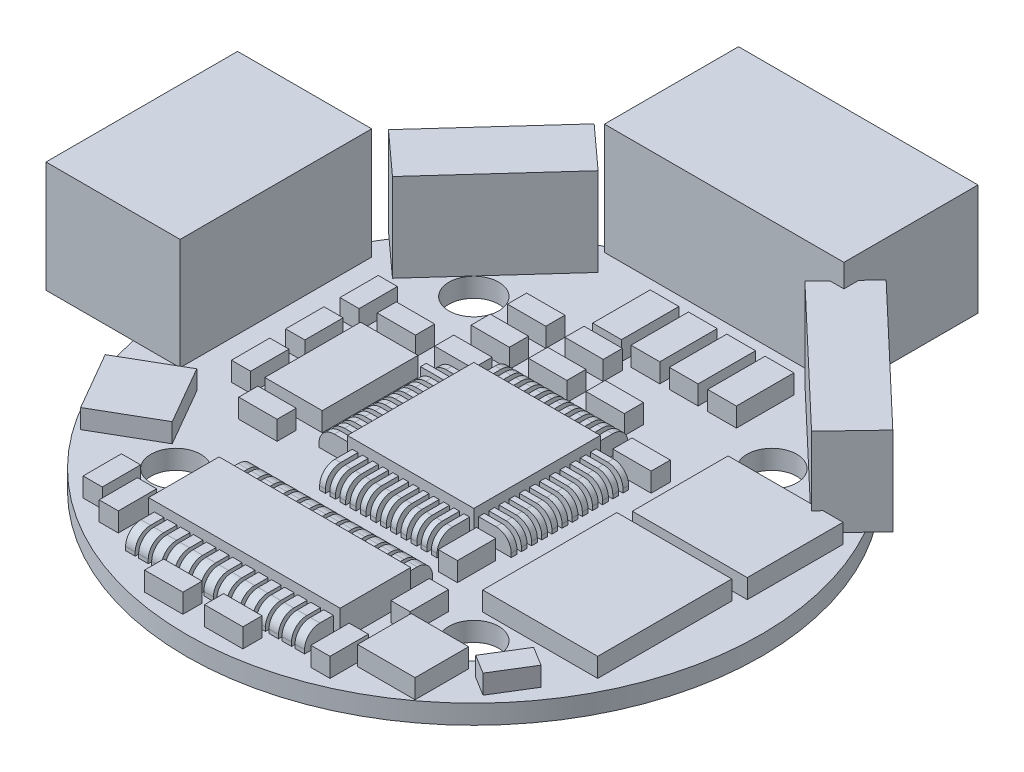
from build123d import *

# Parameters (mm, degrees)
SKETCH_1_R       = 15
SKETCH_1_R_2     = 1.3
EXTRUDE_2_DEPTH  = 1
SKETCH_2_W       = 6.6
SKETCH_2_H       = 6.6
SKETCH_2_W_2     = 10
SKETCH_2_H_2     = 3.68
EXTRUDE_5_DEPTH  = 1.5
SKETCH_3_W       = 5
SKETCH_3_H       = 3.37
EXTRUDE_7_DEPTH  = 1.5
SKETCH_4_W       = 1.7
SKETCH_4_H       = 0.3
SKETCH_4_W_2     = 0.3
SKETCH_4_H_2     = 1.7
EXTRUDE_8_DEPTH  = 1
FILLET_1_R       = 0.8
SKETCH_5_W       = 2
SKETCH_5_H       = 1
SKETCH_5_W_2     = 1
SKETCH_5_H_2     = 2
SKETCH_5_W_3     = 3
SKETCH_5_H_3     = 5
SKETCH_5_W_4     = 1.5
SKETCH_5_H_4     = 3
SKETCH_5_H_5     = 2.8
SKETCH_5_W_5     = 6
SKETCH_5_H_6     = 7
EXTRUDE_9_DEPTH  = 1
SKETCH_6_W       = 0.5
SKETCH_6_H       = 1.5
EXTRUDE_10_DEPTH = 1
FILLET_2_R       = 0.8
SKETCH_7_W       = 7
SKETCH_7_H       = 10
SKETCH_7_W_2     = 12.5
SKETCH_7_H_2     = 7
EXTRUDE_11_DEPTH = 5.8
EXTRUDE_12_DEPTH = 4.6


with BuildPart() as part:
    # 草图1 → 凸台-拉伸2 (new body)
    with BuildSketch(Plane(origin=(0, 0, 0), x_dir=(1, 0, 0), z_dir=(0, 1, 0))):
        with Locations(Location((0, 0, 0), (0, 0, 270))):
            Circle(SKETCH_1_R)
        with Locations(Location((-7.778174593, 7.778174593, 0), (0, 0, 270))):
            Circle(SKETCH_1_R_2, mode=Mode.SUBTRACT)
        with Locations(Location((7.778174593, 7.778174593, 0), (0, 0, 270))):
            Circle(SKETCH_1_R_2, mode=Mode.SUBTRACT)
        with Locations(Location((7.778174593, -7.778174593, 0), (0, 0, 270))):
            Circle(SKETCH_1_R_2, mode=Mode.SUBTRACT)
        with Locations(Location((-7.778174593, -7.778174593, 0), (0, 0, 270))):
            Circle(SKETCH_1_R_2, mode=Mode.SUBTRACT)
    extrude(amount=EXTRUDE_2_DEPTH)

    # 草图2 → 凸台-拉伸5 (add)
    with BuildSketch(Plane(origin=(0, 1, 0), x_dir=(1, 0, 0), z_dir=(0, 1, 0))):
        Rectangle(SKETCH_2_W, SKETCH_2_H)
        with Locations((-0.678174593, -9.46)):
            Rectangle(SKETCH_2_W_2, SKETCH_2_H_2)
    extrude(amount=EXTRUDE_5_DEPTH)

    # 草图3 → 凸台-拉伸7 (add)
    with BuildSketch(Plane.XZ):
        Rectangle(SKETCH_3_W, SKETCH_3_H)
    extrude(amount=EXTRUDE_7_DEPTH)

    # 草图4 → 凸台-拉伸8 (add)
    with BuildSketch(Plane(origin=(0, 1, 0), x_dir=(1, 0, 0), z_dir=(0, 1, 0))):
        with Locations((-4.15, -2.932144042)):
            Rectangle(SKETCH_4_W, SKETCH_4_H)
        with Locations((-4.15, -2.402144042)):
            Rectangle(SKETCH_4_W, SKETCH_4_H)
        with Locations((-4.15, -1.872144042)):
            Rectangle(SKETCH_4_W, SKETCH_4_H)
        with Locations((-4.15, -1.342144042)):
            Rectangle(SKETCH_4_W, SKETCH_4_H)
        with Locations((-4.15, -0.812144042)):
            Rectangle(SKETCH_4_W, SKETCH_4_H)
        with Locations((-4.15, -0.282144042)):
            Rectangle(SKETCH_4_W, SKETCH_4_H)
        with Locations((-4.15, 0.247855958)):
            Rectangle(SKETCH_4_W, SKETCH_4_H)
        with Locations((-4.15, 0.777855958)):
            Rectangle(SKETCH_4_W, SKETCH_4_H)
        with Locations((-4.15, 1.307855958)):
            Rectangle(SKETCH_4_W, SKETCH_4_H)
        with Locations((-4.15, 1.837855958)):
            Rectangle(SKETCH_4_W, SKETCH_4_H)
        with Locations((-4.15, 2.367855958)):
            Rectangle(SKETCH_4_W, SKETCH_4_H)
        with Locations((-4.15, 2.897855958)):
            Rectangle(SKETCH_4_W, SKETCH_4_H)
        with Locations((-2.932144042, 4.15)):
            Rectangle(SKETCH_4_W_2, SKETCH_4_H_2)
        with Locations((-2.402144042, 4.15)):
            Rectangle(SKETCH_4_W_2, SKETCH_4_H_2)
        with Locations((-1.872144042, 4.15)):
            Rectangle(SKETCH_4_W_2, SKETCH_4_H_2)
        with Locations((-1.342144042, 4.15)):
            Rectangle(SKETCH_4_W_2, SKETCH_4_H_2)
        with Locations((-0.812144042, 4.15)):
            Rectangle(SKETCH_4_W_2, SKETCH_4_H_2)
        with Locations((-0.282144042, 4.15)):
            Rectangle(SKETCH_4_W_2, SKETCH_4_H_2)
        with Locations((0.247855958, 4.15)):
            Rectangle(SKETCH_4_W_2, SKETCH_4_H_2)
        with Locations((0.777855958, 4.15)):
            Rectangle(SKETCH_4_W_2, SKETCH_4_H_2)
        with Locations((1.307855958, 4.15)):
            Rectangle(SKETCH_4_W_2, SKETCH_4_H_2)
        with Locations((1.837855958, 4.15)):
            Rectangle(SKETCH_4_W_2, SKETCH_4_H_2)
        with Locations((2.367855958, 4.15)):
            Rectangle(SKETCH_4_W_2, SKETCH_4_H_2)
        with Locations((2.897855958, 4.15)):
            Rectangle(SKETCH_4_W_2, SKETCH_4_H_2)
        with Locations((4.15, 2.932144042)):
            Rectangle(SKETCH_4_W, SKETCH_4_H)
        with Locations((4.15, 2.402144042)):
            Rectangle(SKETCH_4_W, SKETCH_4_H)
        with Locations((4.15, 1.872144042)):
            Rectangle(SKETCH_4_W, SKETCH_4_H)
        with Locations((4.15, 1.342144042)):
            Rectangle(SKETCH_4_W, SKETCH_4_H)
        with Locations((4.15, 0.812144042)):
            Rectangle(SKETCH_4_W, SKETCH_4_H)
        with Locations((4.15, 0.282144042)):
            Rectangle(SKETCH_4_W, SKETCH_4_H)
        with Locations((4.15, -0.247855958)):
            Rectangle(SKETCH_4_W, SKETCH_4_H)
        with Locations((4.15, -0.777855958)):
            Rectangle(SKETCH_4_W, SKETCH_4_H)
        with Locations((4.15, -1.307855958)):
            Rectangle(SKETCH_4_W, SKETCH_4_H)
        with Locations((4.15, -1.837855958)):
            Rectangle(SKETCH_4_W, SKETCH_4_H)
        with Locations((4.15, -2.367855958)):
            Rectangle(SKETCH_4_W, SKETCH_4_H)
        with Locations((4.15, -2.897855958)):
            Rectangle(SKETCH_4_W, SKETCH_4_H)
        with Locations((2.932144042, -4.15)):
            Rectangle(SKETCH_4_W_2, SKETCH_4_H_2)
        with Locations((2.402144042, -4.15)):
            Rectangle(SKETCH_4_W_2, SKETCH_4_H_2)
        with Locations((1.872144042, -4.15)):
            Rectangle(SKETCH_4_W_2, SKETCH_4_H_2)
        with Locations((1.342144042, -4.15)):
            Rectangle(SKETCH_4_W_2, SKETCH_4_H_2)
        with Locations((0.812144042, -4.15)):
            Rectangle(SKETCH_4_W_2, SKETCH_4_H_2)
        with Locations((0.282144042, -4.15)):
            Rectangle(SKETCH_4_W_2, SKETCH_4_H_2)
        with Locations((-0.247855958, -4.15)):
            Rectangle(SKETCH_4_W_2, SKETCH_4_H_2)
        with Locations((-0.777855958, -4.15)):
            Rectangle(SKETCH_4_W_2, SKETCH_4_H_2)
        with Locations((-1.307855958, -4.15)):
            Rectangle(SKETCH_4_W_2, SKETCH_4_H_2)
        with Locations((-1.837855958, -4.15)):
            Rectangle(SKETCH_4_W_2, SKETCH_4_H_2)
        with Locations((-2.367855958, -4.15)):
            Rectangle(SKETCH_4_W_2, SKETCH_4_H_2)
        with Locations((-2.897855958, -4.15)):
            Rectangle(SKETCH_4_W_2, SKETCH_4_H_2)
    extrude(amount=EXTRUDE_8_DEPTH)

    # 圆角1
    fillet_1_edges = [part.edges().sort_by_distance(p)[0] for p in [
        (-5, 2, 0.812144042),
        (-5, 2, 0.282144042),
        (-5, 2, -0.247855958),
        (-5, 2, -0.777855958),
        (-5, 2, -1.307855958),
        (-5, 2, -1.837855958),
        (-5, 2, -2.897855958),
        (-2.932144042, 2, -5),
        (-2.402144042, 2, -5),
        (-1.872144042, 2, -5),
        (-1.342144042, 2, -5),
        (-0.812144042, 2, -5),
        (-0.282144042, 2, -5),
        (0.247855958, 2, -5),
        (0.777855958, 2, -5),
        (1.307855958, 2, -5),
        (1.837855958, 2, -5),
        (2.367855958, 2, -5),
        (2.897855958, 2, -5),
        (5, 2, -2.932144042),
        (5, 2, -2.402144042),
        (5, 2, -1.872144042),
        (5, 2, -1.342144042),
        (5, 2, -0.812144042),
        (5, 2, -0.282144042),
        (5, 2, 0.247855958),
        (5, 2, 0.777855958),
        (5, 2, 1.307855958),
        (5, 2, 1.837855958),
        (5, 2, 2.367855958),
        (5, 2, 2.897855958),
        (2.932144042, 2, 5),
        (2.402144042, 2, 5),
        (1.872144042, 2, 5),
        (1.342144042, 2, 5),
        (0.812144042, 2, 5),
        (0.282144042, 2, 5),
        (-0.247855958, 2, 5),
        (-0.777855958, 2, 5),
        (-1.307855958, 2, 5),
        (-1.837855958, 2, 5),
        (-2.367855958, 2, 5),
        (-5, 2, 2.932144042),
        (-2.897855958, 2, 5),
        (-5, 2, 2.402144042),
        (-5, 2, 1.872144042),
        (-5, 2, 1.342144042),
    ]]
    fillet(fillet_1_edges, radius=FILLET_1_R)

    # 草图5 → 凸台-拉伸9 (add)
    with BuildSketch(Plane(origin=(0, 1, 0), x_dir=(1, 0, 0), z_dir=(0, 1, 0))):
        with Locations((-4.558540812, 4.012589276)):
            Rectangle(SKETCH_5_W, SKETCH_5_H)
        with Locations((-4.558540812, 5.912589276)):
            Rectangle(SKETCH_5_W, SKETCH_5_H)
        with Locations((-4.558540812, 7.812589276)):
            Rectangle(SKETCH_5_W, SKETCH_5_H)
        with Locations((-1.558540812, 7.812589276)):
            Rectangle(SKETCH_5_W, SKETCH_5_H)
        with Locations((-1.558540812, 5.912589276)):
            Rectangle(SKETCH_5_W, SKETCH_5_H)
        with Locations((1.441459188, 5.912589276)):
            Rectangle(SKETCH_5_W, SKETCH_5_H)
        with Locations((4.741459188, 4.012589276)):
            Rectangle(SKETCH_5_W, SKETCH_5_H)
        with Locations((-7.558540812, 4.012589276)):
            Rectangle(SKETCH_5_W, SKETCH_5_H)
        with Locations((-9.726476013, 1.405163932)):
            Rectangle(SKETCH_5_W_2, SKETCH_5_H_2)
        with Locations((-7.075681682, 0.162488479)):
            Rectangle(SKETCH_5_W_3, SKETCH_5_H_3)
        with Locations((-7.365986002, -3.405901665)):
            Rectangle(SKETCH_5_W, SKETCH_5_H)
        with Locations((-9.726476013, 4.236172624)):
            Rectangle(SKETCH_5_W_2, SKETCH_5_H_2)
        with Locations((-9.726476013, -1.42584476)):
            Rectangle(SKETCH_5_W_2, SKETCH_5_H_2)
        with Locations((5.305499137, -8.132819705)):
            Rectangle(SKETCH_5_W_2, SKETCH_5_H_2)
        with Locations((-8.365986002, -10.529204728)):
            Rectangle(SKETCH_5_W_2, SKETCH_5_H_2)
        with Locations((-6.865986002, -11.19239906)):
            Rectangle(SKETCH_5_W_2, SKETCH_5_H_2)
        with Locations((-2.005920473, -13.681060666)):
            Rectangle(SKETCH_5_W, SKETCH_5_H)
        with Locations((1.124051802, -13.681060666)):
            Rectangle(SKETCH_5_W, SKETCH_5_H)
        with Locations((5.232140412, -12.240908315)):
            Rectangle(SKETCH_5_W_2, SKETCH_5_H_2)
        with Locations((4.229571168, -4.587147988)):
            Rectangle(SKETCH_5_W_2, SKETCH_5_H_2)
        with Locations((0.274332726, 10.180677499)):
            Rectangle(SKETCH_5_W_4, SKETCH_5_H_4)
        with Locations((-1.725667274, 10.180677499)):
            Rectangle(SKETCH_5_W_4, SKETCH_5_H_4)
        with Locations((2.274332726, 10.180677499)):
            Rectangle(SKETCH_5_W_4, SKETCH_5_H_4)
        with Locations((4.274332726, 10.180677499)):
            Rectangle(SKETCH_5_W_4, SKETCH_5_H_4)
        Polygon((10.640406132, -7.519378973), (11.638204283, -8.132819705), (10.4865859, -10.00599609), (9.488787749, -9.392555357), align=None)
        with Locations((7.416750567, -10.58546926)):
            Rectangle(SKETCH_5_W_3, SKETCH_5_H_5)
        Polygon((-13.772633078, -5.470216867), (-10.741544165, -3.720216867), (-8.991544165, -6.75130578), (-12.022633078, -8.50130578), align=None)
        with Locations((9.719546692, -2.754925502)):
            Rectangle(SKETCH_5_W_5, SKETCH_5_H_6)
        with Locations((10.063051227, 3.708934816)):
            Rectangle(SKETCH_5_W_5, SKETCH_5_H_3)
    extrude(amount=EXTRUDE_9_DEPTH)

    # 草图6 → 凸台-拉伸10 (add)
    with BuildSketch(Plane(origin=(0, 1, 0), x_dir=(1, 0, 0), z_dir=(0, 1, 0))):
        with Locations((-5.126229135, -12.05)):
            Rectangle(SKETCH_6_W, SKETCH_6_H)
        with Locations((-4.446229135, -12.05)):
            Rectangle(SKETCH_6_W, SKETCH_6_H)
        with Locations((-3.766229135, -12.05)):
            Rectangle(SKETCH_6_W, SKETCH_6_H)
        with Locations((-3.086229135, -12.05)):
            Rectangle(SKETCH_6_W, SKETCH_6_H)
        with Locations((-2.406229135, -12.05)):
            Rectangle(SKETCH_6_W, SKETCH_6_H)
        with Locations((-1.726229135, -12.05)):
            Rectangle(SKETCH_6_W, SKETCH_6_H)
        with Locations((-1.046229135, -12.05)):
            Rectangle(SKETCH_6_W, SKETCH_6_H)
        with Locations((-0.366229135, -12.05)):
            Rectangle(SKETCH_6_W, SKETCH_6_H)
        with Locations((0.313770865, -12.05)):
            Rectangle(SKETCH_6_W, SKETCH_6_H)
        with Locations((0.993770865, -12.05)):
            Rectangle(SKETCH_6_W, SKETCH_6_H)
        with Locations((1.673770865, -12.05)):
            Rectangle(SKETCH_6_W, SKETCH_6_H)
        with Locations((2.353770865, -12.05)):
            Rectangle(SKETCH_6_W, SKETCH_6_H)
        with Locations((3.033770865, -12.05)):
            Rectangle(SKETCH_6_W, SKETCH_6_H)
        with Locations((3.713770865, -12.05)):
            Rectangle(SKETCH_6_W, SKETCH_6_H)
        with Locations((3.713770865, -6.87)):
            Rectangle(SKETCH_6_W, SKETCH_6_H)
        with Locations((3.033770865, -6.87)):
            Rectangle(SKETCH_6_W, SKETCH_6_H)
        with Locations((2.353770865, -6.87)):
            Rectangle(SKETCH_6_W, SKETCH_6_H)
        with Locations((1.673770865, -6.87)):
            Rectangle(SKETCH_6_W, SKETCH_6_H)
        with Locations((0.993770865, -6.87)):
            Rectangle(SKETCH_6_W, SKETCH_6_H)
        with Locations((0.313770865, -6.87)):
            Rectangle(SKETCH_6_W, SKETCH_6_H)
        with Locations((-0.366229135, -6.87)):
            Rectangle(SKETCH_6_W, SKETCH_6_H)
        with Locations((-1.046229135, -6.87)):
            Rectangle(SKETCH_6_W, SKETCH_6_H)
        with Locations((-1.726229135, -6.87)):
            Rectangle(SKETCH_6_W, SKETCH_6_H)
        with Locations((-2.406229135, -6.87)):
            Rectangle(SKETCH_6_W, SKETCH_6_H)
        with Locations((-3.086229135, -6.87)):
            Rectangle(SKETCH_6_W, SKETCH_6_H)
        with Locations((-3.766229135, -6.87)):
            Rectangle(SKETCH_6_W, SKETCH_6_H)
        with Locations((-4.446229135, -6.87)):
            Rectangle(SKETCH_6_W, SKETCH_6_H)
        with Locations((-5.126229135, -6.87)):
            Rectangle(SKETCH_6_W, SKETCH_6_H)
    extrude(amount=EXTRUDE_10_DEPTH)

    # 圆角2
    fillet_2_edges = [part.edges().sort_by_distance(p)[0] for p in [
        (-5.126229135, 2, 12.8),
        (-4.446229135, 2, 12.8),
        (-3.766229135, 2, 12.8),
        (-3.086229135, 2, 12.8),
        (-2.406229135, 2, 12.8),
        (-1.726229135, 2, 12.8),
        (-1.046229135, 2, 12.8),
        (-0.366229135, 2, 12.8),
        (0.313770865, 2, 12.8),
        (0.993770865, 2, 12.8),
        (1.673770865, 2, 12.8),
        (2.353770865, 2, 12.8),
        (3.033770865, 2, 12.8),
        (3.713770865, 2, 12.8),
        (3.713770865, 2, 6.12),
        (3.033770865, 2, 6.12),
        (2.353770865, 2, 6.12),
        (1.673770865, 2, 6.12),
        (0.993770865, 2, 6.12),
        (0.313770865, 2, 6.12),
        (-0.366229135, 2, 6.12),
        (-1.046229135, 2, 6.12),
        (-1.726229135, 2, 6.12),
        (-2.406229135, 2, 6.12),
        (-3.086229135, 2, 6.12),
        (-3.766229135, 2, 6.12),
        (-4.446229135, 2, 6.12),
        (-5.126229135, 2, 6.12),
    ]]
    fillet(fillet_2_edges, radius=FILLET_2_R)

    # 草图7 → 凸台-拉伸11 (add)
    with BuildSketch(Plane(origin=(0, 1, 0), x_dir=(1, 0, 0), z_dir=(0, 1, 0))):
        with Locations((-15.726476013, 1.893701838)):
            Rectangle(SKETCH_7_W, SKETCH_7_H)
        with Locations((-0.114070009, 16.680677499)):
            Rectangle(SKETCH_7_W_2, SKETCH_7_H_2)
    extrude(amount=EXTRUDE_11_DEPTH)

    # 草图8 → 凸台-拉伸12 (add)
    with BuildSketch(Plane(origin=(0, 1, 0), x_dir=(1, 0, 0), z_dir=(0, 1, 0))):
        Polygon((-12.948396938, 8.492675622), (-10.725436084, 6.478117348), (-5.621888456, 12.109618179), (-7.84484931, 14.124176453), align=None)
        Polygon((4.766563399, 12.51340482), (6.832811785, 14.688403121), (13.792806347, 8.076408286), (11.726557961, 5.901409985), align=None)
    extrude(amount=EXTRUDE_12_DEPTH)


solid = part.part
